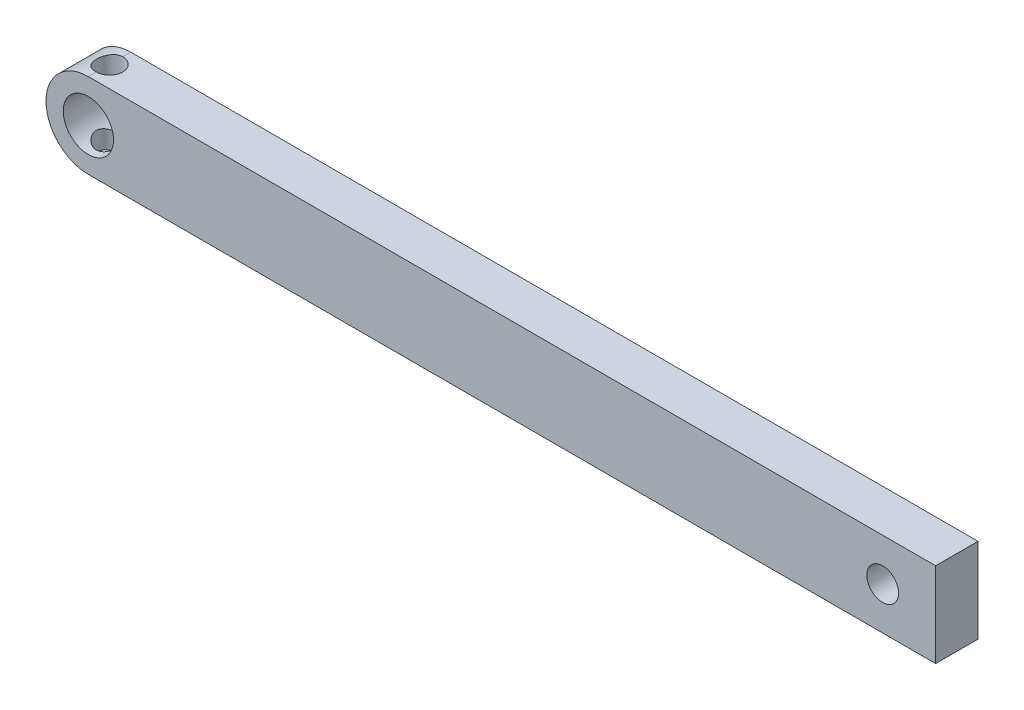
from build123d import *

# Parameters (mm, degrees)
BOSS_EXTRUDE1_DEPTH = 8
SKETCH2_R           = 4.75
SKETCH2_R_2         = 3
CUT_EXTRUDE1_DEPTH  = 20
SKETCH3_R           = 4
CUT_EXTRUDE2_DEPTH  = 0.5
SKETCH4_R           = 2.5
CUT_EXTRUDE3_DEPTH  = 20


with BuildPart() as part:
    # Sketch1 → Boss-Extrude1 (new body)
    with BuildSketch(Plane.XY):
        with BuildLine():
            Line((0, -8), (160, -8))
            Line((160, -8), (160, 8))
            Line((160, 8), (0, 8))
            ThreePointArc((0, 8), (-8, 0), (0, -8))
        make_face()
    extrude(amount=BOSS_EXTRUDE1_DEPTH)

    # Sketch2 → Cut-Extrude1 (cut, symmetric)
    with BuildSketch(Plane.XY):
        Circle(SKETCH2_R)
        with Locations((150, 0)):
            Circle(SKETCH2_R_2)
    extrude(amount=CUT_EXTRUDE1_DEPTH, both=True, mode=Mode.SUBTRACT)

    # Sketch3 → Cut-Extrude2 (cut, symmetric)
    with BuildSketch(Plane.XY):
        with Locations((30, 0)):
            Circle(SKETCH3_R)
    extrude(amount=CUT_EXTRUDE2_DEPTH, both=True, mode=Mode.SUBTRACT)

    # Sketch4 → Cut-Extrude3 (cut, symmetric)
    with BuildSketch(Plane(origin=(0, 0, 0), x_dir=(1, 0, 0), z_dir=(0, 1, 0))):
        with Locations((0, -4)):
            Circle(SKETCH4_R)
    extrude(amount=CUT_EXTRUDE3_DEPTH, both=True, mode=Mode.SUBTRACT)


solid = part.part
